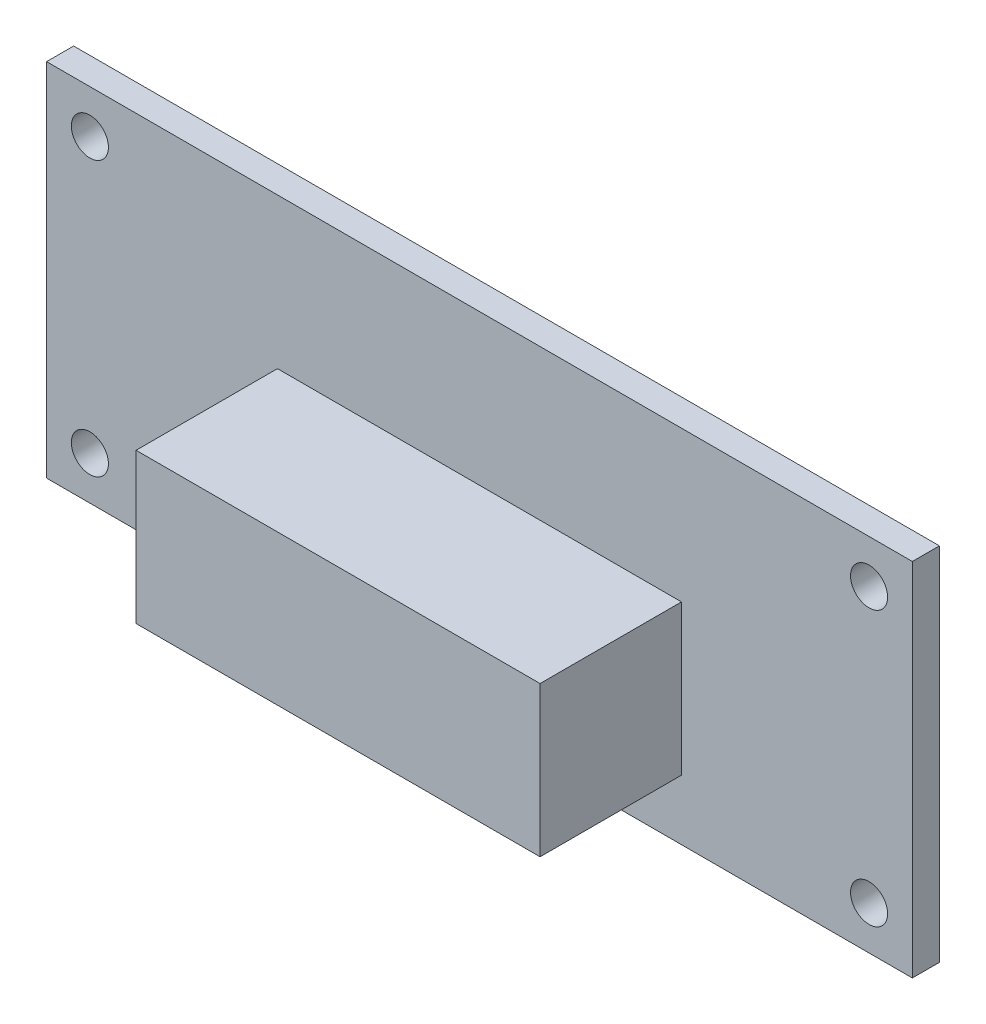
from build123d import *

# Parameters (mm, degrees)
SKETCH1_W           = 76.2
SKETCH1_H           = 31.75
BOSS_EXTRUDE1_DEPTH = 2.38125
SKETCH2_W           = 35.56
SKETCH2_H           = 13.208
BOSS_EXTRUDE2_DEPTH = 12.446


with BuildPart() as part:
    # Sketch1 → Boss-Extrude1 (new body)
    with BuildSketch(Plane.XY):
        Rectangle(SKETCH1_W, SKETCH1_H)
    extrude(amount=BOSS_EXTRUDE1_DEPTH)

    # Sketch5 → #4 Clearance Hole1 (revolve, cut)
    with BuildSketch(Plane(origin=(-34.29, 12.065, 2.38125), x_dir=(0, -1, 0), z_dir=(1, 0, 0))):
        Polygon((0, 0), (0, 4.155574487), (1.63195, 3.175), (1.63195, 0), align=None)
    f_4_clearance_hole1 = revolve(axis=Axis((-34.29, 12.065, 8.73125), (0, 0, -1)), mode=Mode.SUBTRACT)

    # Mirror1: #4 Clearance Hole1 across plane
    add(f_4_clearance_hole1.mirror(Plane(origin=(0, 0, 0), x_dir=(0, 0, 1), z_dir=(1, 0, 0))), mode=Mode.SUBTRACT)

    # Mirror2 copy 1 sketch → Mirror2 copy 1 (revolve, cut)
    with BuildSketch(Plane(origin=(34.29, -12.065, 2.38125), x_dir=(0, 1, 0), z_dir=(-1, 0, 0))):
        Polygon((0, 0), (0, 4.155574487), (1.63195, 3.175), (1.63195, 0), align=None)
    revolve(axis=Axis((34.29, -12.065, 8.73125), (0, 0, -1)), mode=Mode.SUBTRACT)

    # Mirror2 copy 2 sketch → Mirror2 copy 2 (revolve, cut)
    with BuildSketch(Plane(origin=(-34.29, -12.065, 2.38125), x_dir=(0, 1, 0), z_dir=(1, 0, 0))):
        Polygon((0, 0), (0, -4.155574487), (1.63195, -3.175), (1.63195, 0), align=None)
    revolve(axis=Axis((-34.29, -12.065, 8.73125), (0, 0, 1)), mode=Mode.SUBTRACT)

    # Sketch2 → Boss-Extrude2 (add)
    with BuildSketch(Plane.XY.offset(2.38125)):
        with Locations((0, -3.970482907)):
            Rectangle(SKETCH2_W, SKETCH2_H)
    extrude(amount=BOSS_EXTRUDE2_DEPTH)


solid = part.part
